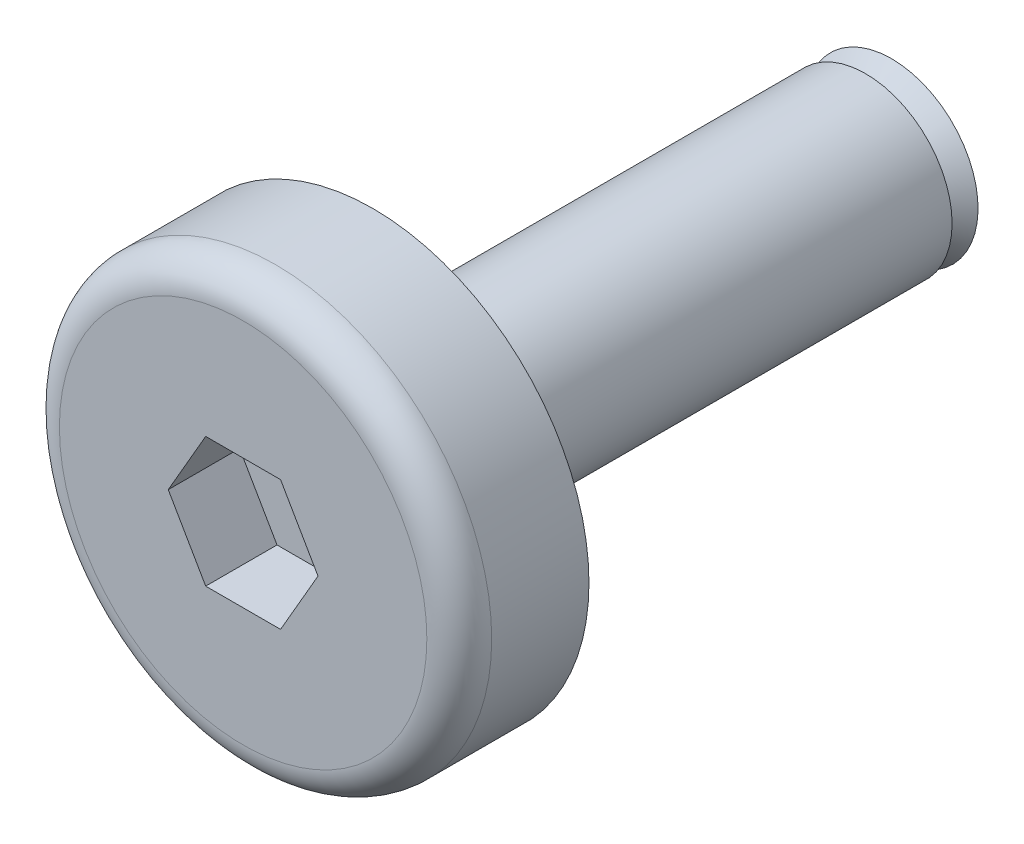
from build123d import *

# Parameters (mm, degrees)
F_0135_CYLINDER_SKETCH_R    = 2.5
F_0135_CYLINDER_DEPTH       = 1.5
F_0136_FILLET_R             = 0.375
F_0137_EXTRUDE_DEPTH        = 0.835
F_0137_EXTRUDE_ROTATE_ANGLE = 120
F_0140_CYLINDER_SKETCH_R    = 1
F_0140_CYLINDER_DEPTH       = 5.7
F_0141_CONE_ROTATE_ANGLE    = 90


with BuildPart() as part:
    # 0135_cylinder_Sketch → 0135_cylinder (new body)
    with BuildSketch(Plane.XY):
        Circle(F_0135_CYLINDER_SKETCH_R)
    extrude(amount=F_0135_CYLINDER_DEPTH)

    # 0136_fillet
    f_0136_fillet_edges = [part.edges().sort_by_distance(p)[0] for p in [
        (-2.5, 0, 1.5),
    ]]
    fillet(f_0136_fillet_edges, radius=F_0136_FILLET_R)


with BuildPart() as body_2:
    # 0137_extrude_Sketch → 0137_extrude (new body)
    with BuildSketch(Plane.XY):
        Polygon((0, 0), (0.866025404, 0), (1.299038106, 0.75), (0.866025404, 1.5), (0, 1.5), (-0.433012702, 0.75), align=None)
    extrude(amount=F_0137_EXTRUDE_DEPTH)


with BuildPart() as body_2_1:
    # 0137_extrude_Rotate: read off the stored shape, not the designer's step
    # 0137_extrude_Rotate: moved
    add(body_2.part.rotate(Axis((0, 0, 0), (0, 0, 1)), F_0137_EXTRUDE_ROTATE_ANGLE))


with BuildPart() as body_2_2:
    # 0137_extrude_Translate: moved
    add(body_2_1.part.moved(Location((0.866025404, 0, 0.675))))


with BuildPart() as part_1:
    add(part.part)

    # 0139_sub: cut body 2
    add(body_2_2.part, mode=Mode.SUBTRACT)


with BuildPart() as body_2_2_1:
    # 0140_cylinder_Sketch → 0140_cylinder (new body)
    with BuildSketch(Plane.XY):
        Circle(F_0140_CYLINDER_SKETCH_R)
    extrude(amount=F_0140_CYLINDER_DEPTH)


with BuildPart() as body_2_2_2:
    # 0140_cylinder_Translate: moved
    add(body_2_2_1.part.moved(Location((0, 0, -5.7))))


with BuildPart() as body_3:
    # 0141_cone_Sketch → 0141_cone (revolve)
    with BuildSketch(Plane.XY, mode=Mode.PRIVATE) as f_0141_cone_sk:
        Polygon((0, 0), (1, 0), (0.7, 0.3), (0, 0.3), align=None)
    revolve(f_0141_cone_sk.sketch.rotate(Axis((0, -100, 0), (0, 1, 0)), 90), axis=Axis((0, -100, 0), (0, 1, 0)))


with BuildPart() as body_3_1:
    # 0141_cone_Rotate: moved
    add(body_3.part.rotate(Axis((0, 0, 0), (1, 0, 0)), F_0141_CONE_ROTATE_ANGLE))


with BuildPart() as body_3_2:
    # 0141_cone_Translate: moved
    add(body_3_1.part.moved(Location((0, 0, -6))))


with BuildPart() as body_2_2_3:
    add(body_2_2_2.part)

    # 0143_add: union body 3
    add(body_3_2.part)


with BuildPart() as part_2:
    add(part_1.part)

    # 0144_add: union body 2 2
    add(body_2_2_3.part)


solid = part_2.part
